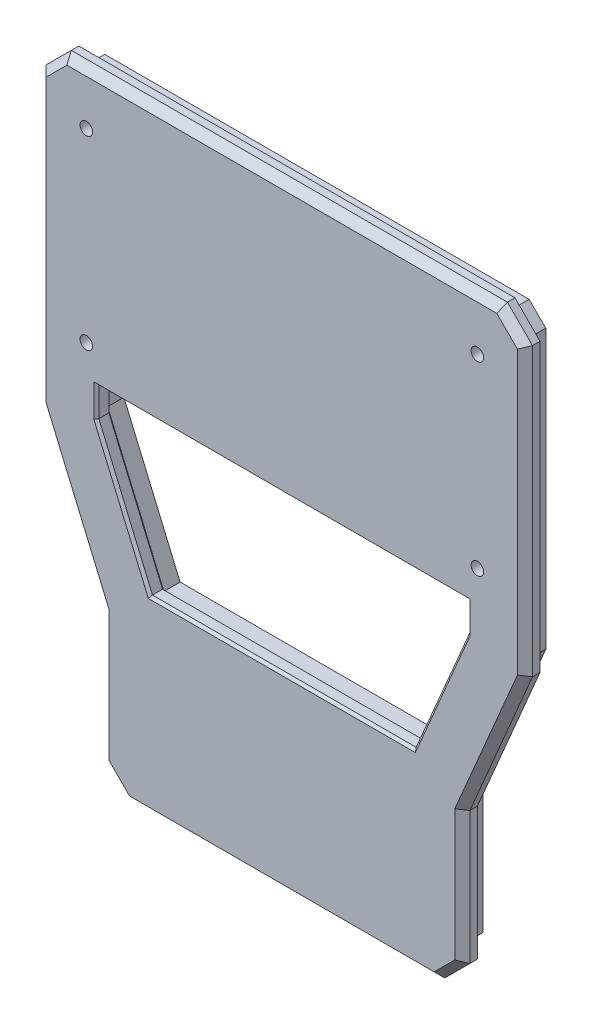
from build123d import *

# Parameters (mm, degrees)
BOSS_EXTRUDE1_DEPTH = 3
CHAMFER1_SIZE       = 1.5
CUT_EXTRUDE1_REACH  = 347.343
CHAMFER2_SIZE       = 0.5
BOSS_EXTRUDE2_DEPTH = 4
RIB7_START          = -4
RIB7_OUTLINE_W      = 28
RIB7_OUTLINE_H      = 13
RIB7_OUTLINE_H_2    = 8.5
RIB7_OUTLINE_W_2    = 25.952178387
RIB7_OUTLINE_H_3    = 14.5
RIB7_OUTLINE_H_4    = 18
RIB7_DEPTH          = 4
CUT_EXTRUDE2_REACH  = 347.401
SKETCH7_R           = 1.25


# Read off the part's stored shape, not the designer's step: Rib7
with BuildPart() as part:
    # Sketch1 → Boss-Extrude1 (new body)
    with BuildSketch(Plane.XY):
        Polygon((73.544754824, 275.183613143), (73.544754824, 332.408166803), (68.544754824, 337.408166803), (-18.455245176, 337.408166803), (-23.455245176, 332.408166803), (-23.455245176, 275.183613143), (-10.955245176, 245.835787056), (-10.955245176, 219.408166803), (-5.955245176, 214.408166803), (56.044754824, 214.408166803), (61.044754824, 219.408166803), (61.044754824, 245.835787056), align=None)
    extrude(amount=BOSS_EXTRUDE1_DEPTH)

    # Chamfer1
    chamfer1_edges = [part.edges().sort_by_distance(p)[0] for p in [
        (71.044754824, 334.908166803, 3),
        (25.044754824, 337.408166803, 3),
        (-20.955245176, 334.908166803, 3),
        (-23.455245176, 303.795889973, 3),
        (-17.205245176, 260.509700099, 3),
        (-10.955245176, 232.621976929, 3),
        (-8.455245176, 216.908166803, 3),
        (25.044754824, 214.408166803, 3),
        (58.544754824, 216.908166803, 3),
        (61.044754824, 232.621976929, 3),
        (67.294754824, 260.509700099, 3),
        (73.544754824, 303.795889973, 3),
    ]]
    chamfer(chamfer1_edges, length=CHAMFER1_SIZE)

    # Sketch2 → Cut-Extrude1 (cut, up to next)
    with BuildSketch(Plane.XY.offset(3), mode=Mode.PRIVATE) as cut_extrude1_sk1:
        Polygon((-1.254917898, 252.408166803), (51.344427546, 252.408166803), (62.044754824, 277.530674324), (62.044754824, 283.408166803), (-11.955245176, 283.408166803), (-11.955245176, 277.530674324), align=None)
    cut_extrude1_tool1 = extrude(cut_extrude1_sk1.sketch, amount=-CUT_EXTRUDE1_REACH, mode=Mode.PRIVATE) & part.part
    add(cut_extrude1_tool1.solids().sort_by_distance((25.044755, 268.854037, 3))[0], mode=Mode.SUBTRACT)

    # Chamfer2
    chamfer2_edges = [part.edges().sort_by_distance(p)[0] for p in [
        (56.694591185, 264.969420563, 3),
        (62.044754824, 280.469420563, 3),
        (25.044754824, 283.408166803, 3),
        (-11.955245176, 280.469420563, 3),
        (-6.605081537, 264.969420563, 3),
        (25.044754824, 252.408166803, 3),
        (62.044754824, 280.469420563, 0),
        (56.694591185, 264.969420563, 0),
        (25.044754824, 252.408166803, 0),
        (-6.605081537, 264.969420563, 0),
        (-11.955245176, 280.469420563, 0),
        (25.044754824, 283.408166803, 0),
    ]]
    chamfer(chamfer2_edges, length=CHAMFER2_SIZE)

    # Sketch4 → Boss-Extrude2 (add)
    with BuildSketch(Plane(origin=(0, 0, 0), x_dir=(-1, 0, 0), z_dir=(0, 0, -1))):
        Polygon((-70.694754824, 275.765276131), (-58.194754824, 246.417450044), (-58.194754824, 220.588675455), (-54.864246171, 217.258166803), (4.774736523, 217.258166803), (8.105245176, 220.588675455), (8.105245176, 246.417450044), (20.605245176, 275.765276131), (20.605245176, 331.22765815), (17.274736523, 334.558166803), (-67.364246171, 334.558166803), (-70.694754824, 331.22765815), align=None)
        Polygon((-67.694754824, 276.377552961), (-55.194754824, 247.029726874), (-55.194754824, 221.831316142), (-53.621605484, 220.258166803), (3.532095836, 220.258166803), (5.105245176, 221.831316142), (5.105245176, 247.029726874), (17.605245176, 276.377552961), (17.605245176, 329.985017463), (16.032095836, 331.558166803), (-66.121605484, 331.558166803), (-67.694754824, 329.985017463), align=None, mode=Mode.SUBTRACT)
    extrude(amount=BOSS_EXTRUDE2_DEPTH)

    # Rib7 outline → Rib7 (add)
    with BuildSketch(Plane(origin=(0, 0, -4), x_dir=(-1, 0, 0), z_dir=(0, 0, -1)).offset(RIB7_START)):
        Polygon((-53.996933211, 286.908166803), (-67.694754824, 286.908166803), (-67.694754824, 284.908166803), (-65.544754824, 284.908166803), (-65.544754824, 277.836965709), (-67.694754824, 277.398167314), (-67.694754824, 276.377552961), (-67.294814776, 275.438563283), (-65.144814776, 275.877361678), (-54.145181191, 250.052135), (-55.645281657, 248.087485525), (-55.194754824, 247.029726874), (-55.194754824, 245.381922872), (-52.502304985, 248.908166803), (-41.044754824, 248.908166803), (-41.044754824, 240.408166803), (-55.194754824, 240.408166803), (-55.194754824, 238.408166803), (-41.044754824, 238.408166803), (-41.044754824, 225.408166803), (-55.194754824, 225.408166803), (-55.194754824, 223.408166803), (-41.044754824, 223.408166803), (-41.044754824, 220.258166803), (-39.044754824, 220.258166803), (-39.044754824, 223.408166803), (-11.044754824, 223.408166803), (-11.044754824, 220.258166803), (-9.044754824, 220.258166803), (-9.044754824, 223.408166803), (5.105245176, 223.408166803), (5.105245176, 225.408166803), (-9.044754824, 225.408166803), (-9.044754824, 238.408166803), (5.105245176, 238.408166803), (5.105245176, 240.408166803), (-9.044754824, 240.408166803), (-9.044754824, 248.908166803), (2.412795337, 248.908166803), (5.105245176, 245.381922872), (5.105245176, 247.029726874), (5.555772009, 248.087485525), (4.055671543, 250.052135), (15.055305128, 275.877361678), (17.205305128, 275.438563283), (17.605245176, 276.377552961), (17.605245176, 277.398167314), (15.455245176, 277.836965709), (15.455245176, 284.908166803), (17.605245176, 284.908166803), (17.605245176, 286.908166803), (3.907423563, 286.908166803), (3.907423563, 301.408166803), (17.605245176, 301.408166803), (17.605245176, 303.408166803), (3.907423563, 303.408166803), (3.907423563, 321.408166803), (17.605245176, 321.408166803), (17.605245176, 323.408166803), (3.907423563, 323.408166803), (3.907423563, 331.558166803), (1.907423563, 331.558166803), (1.907423563, 323.408166803), (-24.044754824, 323.408166803), (-24.044754824, 331.558166803), (-26.044754824, 331.558166803), (-26.044754824, 323.408166803), (-51.996933211, 323.408166803), (-51.996933211, 331.558166803), (-53.996933211, 331.558166803), (-53.996933211, 323.408166803), (-67.694754824, 323.408166803), (-67.694754824, 321.408166803), (-53.996933211, 321.408166803), (-53.996933211, 303.408166803), (-67.694754824, 303.408166803), (-67.694754824, 301.408166803), (-53.996933211, 301.408166803), align=None)
        with Locations((-25.044754824, 231.908166803)):
            Rectangle(RIB7_OUTLINE_W, RIB7_OUTLINE_H, mode=Mode.SUBTRACT)
        with Locations((-25.044754824, 244.658166803)):
            Rectangle(RIB7_OUTLINE_W, RIB7_OUTLINE_H_2, mode=Mode.SUBTRACT)
        Polygon((13.455245176, 277.224535909), (2.246421297, 250.908166803), (-52.335930945, 250.908166803), (-63.544754824, 277.224535909), (-63.544754824, 284.908166803), (13.455245176, 284.908166803), align=None, mode=Mode.SUBTRACT)
        with Locations((-39.020844018, 294.158166803)):
            Rectangle(RIB7_OUTLINE_W_2, RIB7_OUTLINE_H_3, mode=Mode.SUBTRACT)
        with Locations((-39.020844018, 312.408166803)):
            Rectangle(RIB7_OUTLINE_W_2, RIB7_OUTLINE_H_4, mode=Mode.SUBTRACT)
        with Locations((-11.06866563, 294.158166803)):
            Rectangle(RIB7_OUTLINE_W_2, RIB7_OUTLINE_H_3, mode=Mode.SUBTRACT)
        with Locations((-11.06866563, 312.408166803)):
            Rectangle(RIB7_OUTLINE_W_2, RIB7_OUTLINE_H_4, mode=Mode.SUBTRACT)
    extrude(amount=RIB7_DEPTH)

    # Sketch7 → Cut-Extrude2 (cut, up to next)
    with BuildSketch(Plane.XY.offset(3), mode=Mode.PRIVATE) as cut_extrude2_sk1:
        with Locations((-13.955245176, 289.908166803)):
            Circle(SKETCH7_R)
    cut_extrude2_tool1 = extrude(cut_extrude2_sk1.sketch, amount=-CUT_EXTRUDE2_REACH, mode=Mode.PRIVATE) & part.part
    # Sketch7 → Cut-Extrude2 (cut, up to next)
    with BuildSketch(Plane.XY.offset(3), mode=Mode.PRIVATE) as cut_extrude2_sk2:
        with Locations((64.044754824, 289.908166803)):
            Circle(SKETCH7_R)
    cut_extrude2_tool2 = extrude(cut_extrude2_sk2.sketch, amount=-CUT_EXTRUDE2_REACH, mode=Mode.PRIVATE) & part.part
    # Sketch7 → Cut-Extrude2 (cut, up to next)
    with BuildSketch(Plane.XY.offset(3), mode=Mode.PRIVATE) as cut_extrude2_sk3:
        with Locations((64.044754824, 326.908166803)):
            Circle(SKETCH7_R)
    cut_extrude2_tool3 = extrude(cut_extrude2_sk3.sketch, amount=-CUT_EXTRUDE2_REACH, mode=Mode.PRIVATE) & part.part
    # Sketch7 → Cut-Extrude2 (cut, up to next)
    with BuildSketch(Plane.XY.offset(3), mode=Mode.PRIVATE) as cut_extrude2_sk4:
        with Locations((-13.955245176, 326.908166803)):
            Circle(SKETCH7_R)
    cut_extrude2_tool4 = extrude(cut_extrude2_sk4.sketch, amount=-CUT_EXTRUDE2_REACH, mode=Mode.PRIVATE) & part.part
    add(cut_extrude2_tool1.solids().sort_by_distance((-13.955245, 289.908167, 3))[0], mode=Mode.SUBTRACT)
    add(cut_extrude2_tool2.solids().sort_by_distance((64.044755, 289.908167, 3))[0], mode=Mode.SUBTRACT)
    add(cut_extrude2_tool3.solids().sort_by_distance((64.044755, 326.908167, 3))[0], mode=Mode.SUBTRACT)
    add(cut_extrude2_tool4.solids().sort_by_distance((-13.955245, 326.908167, 3))[0], mode=Mode.SUBTRACT)


solid = part.part
